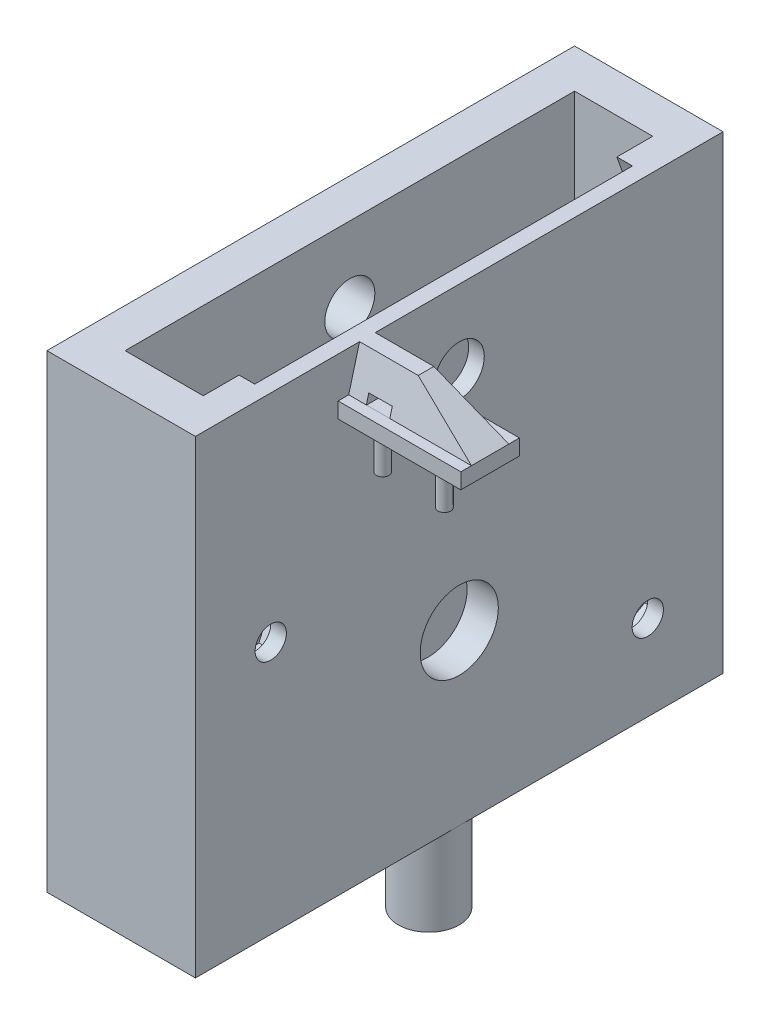
from build123d import *

# Parameters (mm, degrees)
SKETCH3_R                      = 4.953
POST_DEPTH                     = 13.97
SKETCH4_W                      = 24.13
SKETCH4_H                      = 85.725
BASE_DEPTH                     = 6.35
SKETCH5_W                      = 24.13
SKETCH5_H                      = 85.725
SKETCH5_W_2                    = 15.24
SKETCH5_H_2                    = 73.025
CAVITY_DEPTH                   = 69.85
MOTORHOLES_REACH               = 104.714
SKETCH8_R                      = 6.35
SKETCH8_R_2                    = 2.54
POWERSCREWHOLES_REACH          = 104.714
SKETCH7_R                      = 4.064
NUT_SOCKET_DEPTH               = 2.54
SKETCH12_W                     = 9.525
SKETCH12_H                     = 2.54
LIMITSWITCHSUPPORT_DEPTH       = 19.939
SKETCH20_R                     = 1.016
BOSS_EXTRUDE3_DEPTH            = 6.096
ZIPTIECUTOUT_REACH             = 106.211
SKETCH22_W                     = 3.81
SKETCH22_H                     = 1.524
ZIPTIECUTOUT_DIRECTION_2_REACH = 106.211


with BuildPart() as part:
    # Sketch3 → Post (new body)
    with BuildSketch(Plane(origin=(0, 0, 0), x_dir=(1, 0, 0), z_dir=(0, 1, 0))):
        with Locations(Location((0, 0, 0), (0, 0, 270))):
            Circle(SKETCH3_R)
    extrude(amount=POST_DEPTH)

    # Sketch4 → Base (add)
    with BuildSketch(Plane(origin=(0, 13.97, 0), x_dir=(1, 0, 0), z_dir=(0, 1, 0))):
        with Locations((-7.112, 0)):
            Rectangle(SKETCH4_W, SKETCH4_H)
    extrude(amount=BASE_DEPTH)

    # Sketch5 → Cavity (add)
    with BuildSketch(Plane(origin=(0, 20.32, 0), x_dir=(1, 0, 0), z_dir=(0, 1, 0))):
        with Locations((-7.112, 0)):
            Rectangle(SKETCH5_W, SKETCH5_H)
        with Locations((-5.207, 0)):
            Rectangle(SKETCH5_W_2, SKETCH5_H_2, mode=Mode.SUBTRACT)
    extrude(amount=CAVITY_DEPTH)

    # Sketch8 → MotorHoles (cut, up to next)
    with BuildSketch(Plane(origin=(4.953, 0, 0), x_dir=(0, 0, -1), z_dir=(1, 0, 0)), mode=Mode.PRIVATE) as motorholes_sk1:
        with Locations((0, 41.47)):
            Circle(SKETCH8_R)
    motorholes_tool1 = extrude(motorholes_sk1.sketch, amount=-MOTORHOLES_REACH, mode=Mode.PRIVATE) & part.part
    # Sketch8 → MotorHoles (cut, up to next)
    with BuildSketch(Plane(origin=(4.953, 0, 0), x_dir=(0, 0, -1), z_dir=(1, 0, 0)), mode=Mode.PRIVATE) as motorholes_sk2:
        with Locations((-30.629352104, 55.107066169)):
            Circle(SKETCH8_R_2)
    motorholes_tool2 = extrude(motorholes_sk2.sketch, amount=-MOTORHOLES_REACH, mode=Mode.PRIVATE) & part.part
    # Sketch8 → MotorHoles (cut, up to next)
    with BuildSketch(Plane(origin=(4.953, 0, 0), x_dir=(0, 0, -1), z_dir=(1, 0, 0)), mode=Mode.PRIVATE) as motorholes_sk3:
        with Locations((30.629352104, 27.832933831)):
            Circle(SKETCH8_R_2)
    motorholes_tool3 = extrude(motorholes_sk3.sketch, amount=-MOTORHOLES_REACH, mode=Mode.PRIVATE) & part.part
    add(motorholes_tool1.solids().sort_by_distance((4.953, 41.47, 0))[0], mode=Mode.SUBTRACT)
    add(motorholes_tool2.solids().sort_by_distance((4.953, 55.107066, 30.629352))[0], mode=Mode.SUBTRACT)
    add(motorholes_tool3.solids().sort_by_distance((4.953, 27.832934, -30.629352))[0], mode=Mode.SUBTRACT)

    # PowerscrewHoles: up to this face of the body (flat: up to its plane)
    powerscrewholes_end = Plane(part.part.faces().sort_by_distance((-19.177, 52.07, 0))[0])
    # Sketch7 → PowerscrewHoles (cut, up to the picked face)
    with BuildSketch(Plane(origin=(4.953, 0, 0), x_dir=(0, 0, -1), z_dir=(1, 0, 0)), mode=Mode.PRIVATE) as powerscrewholes_sk1:
        with Locations((0, 77.9825)):
            Circle(SKETCH7_R)
    powerscrewholes_tool1 = split(extrude(powerscrewholes_sk1.sketch, amount=-POWERSCREWHOLES_REACH, mode=Mode.PRIVATE), bisect_by=powerscrewholes_end, keep=Keep.BOTH, mode=Mode.PRIVATE)
    add(powerscrewholes_tool1.solids().sort_by(Axis((4.953, 77.9825, 0), (-1, 0, 0)))[0], mode=Mode.SUBTRACT)

    # Sketch10 → Nut Socket (add)
    with BuildSketch(Plane.ZY.offset(-2.413)):
        with BuildLine():
            Line((-36.5125, 90.17), (-30.688519739, 90.17))
            ThreePointArc((-30.688519739, 90.17), (-28.656384533, 61.577256158), (-5.028558234, 45.347641304))
            ThreePointArc((-5.028558234, 45.347641304), (0, 35.12), (5.028558234, 45.347641304))
            ThreePointArc((5.028558234, 45.347641304), (28.656384533, 61.577256158), (30.688519739, 90.17))
            Line((30.688519739, 90.17), (36.5125, 90.17))
            Line((36.5125, 90.17), (36.5125, 20.32))
            Line((36.5125, 20.32), (-36.5125, 20.32))
            Line((-36.5125, 20.32), (-36.5125, 90.17))
        make_face()
        Polygon((-26.057352104, 30.472579262), (-30.629352104, 33.112224692), (-35.201352104, 30.472579262), (-35.201352104, 25.1932884), (-30.629352104, 22.553642969), (-26.057352104, 25.1932884), align=None, mode=Mode.SUBTRACT)
        Polygon((32.712972872, 50.256351119), (35.872004948, 54.486177161), (33.788384179, 59.336892211), (28.545731335, 59.957781219), (25.38669926, 55.727955177), (27.470320028, 50.877240127), align=None, mode=Mode.SUBTRACT)
    extrude(amount=NUT_SOCKET_DEPTH)

    # Sketch12 → LimitSwitchSupport (add)
    with BuildSketch(Plane(origin=(4.953, 0, 0), x_dir=(0, 0, -1), z_dir=(1, 0, 0))):
        with Locations((-14.9225, 82.3005)):
            Rectangle(SKETCH12_W, SKETCH12_H)
    extrude(amount=LIMITSWITCHSUPPORT_DEPTH)

    # Rib2: read off the stored shape, not the designer's step
    # Rib2: loft between two sections, ruled curve by curve
    rib2_from = [
        Edge.make_line((14.478, 90.17, 13.6525), (14.478, 90.17, 16.1925)),
        Edge.make_line((4.953, 90.17, 16.1925), (14.478, 90.17, 16.1925)),
        Edge.make_line((4.953, 90.17, 13.6525), (14.478, 90.17, 13.6525)),
        Edge.make_line((4.953, 90.17, 13.6525), (4.953, 90.17, 16.1925)),
    ]
    rib2_to = [
        Edge.make_line((24.892, 83.5705, 11.884169305), (24.892, 83.5705, 17.960830695)),
        Edge.make_line((4.953, 83.5705, 17.960830695), (24.892, 83.5705, 17.960830695)),
        Edge.make_line((4.953, 83.5705, 11.884169305), (24.892, 83.5705, 11.884169305)),
        Edge.make_line((4.953, 83.5705, 11.884169305), (4.953, 83.5705, 17.960830695)),
    ]
    rib2 = Solid(Shell([*[Face.make_surface_from_curves(rib2_from[k], rib2_to[k]) for k in range(4)], Face(Wire(rib2_from)), Face(Wire(rib2_to))]))
    add(rib2)

    # Sketch20 → Boss-Extrude3 (add)
    with BuildSketch(Plane.XZ.offset(-81.0305)):
        with Locations(Location((9.906, 17.399, 0), (0, 0, 90))):
            Circle(SKETCH20_R)
        with Locations(Location((19.939, 17.399, 0), (0, 0, 90))):
            Circle(SKETCH20_R)
    extrude(amount=BOSS_EXTRUDE3_DEPTH)

    # ZipTieCutout: up to this plane
    ziptiecutout_end = Plane(origin=(2.8575, 90.17, 13.6525), z_dir=(0, -0.25881904510252135, 0.9659258262890681))
    # Sketch22 → ZipTieCutout (cut, up to the surface)
    with BuildSketch(Plane(origin=(0, 7.096196959, 14.9225), x_dir=(0.9999812488409504, 0.00612388491835337, 0), z_dir=(0, 0, 1)), mode=Mode.PRIVATE) as ziptiecutout_sk1:
        with Locations((10.192898839, 77.16364952)):
            Rectangle(SKETCH22_W, SKETCH22_H)
    ziptiecutout_tool1 = split(extrude(ziptiecutout_sk1.sketch, amount=-ZIPTIECUTOUT_REACH, mode=Mode.PRIVATE), bisect_by=ziptiecutout_end, keep=Keep.BOTH, mode=Mode.PRIVATE)
    add(ziptiecutout_tool1.solids().sort_by_distance((9.720166, 84.32082, 14.9225))[0], mode=Mode.SUBTRACT)

    # ZipTieCutout direction 2: up to this plane
    ziptiecutout_direction_2_end = Plane(origin=(2.8575, 90.17, 16.1925), z_dir=(0, 0.25881904510252135, 0.9659258262890681))
    # Sketch22 → ZipTieCutout direction 2 (cut, up to the surface)
    with BuildSketch(Plane(origin=(0, 7.096196959, 14.9225), x_dir=(0.9999812488409504, 0.00612388491835337, 0), z_dir=(0, 0, 1)), mode=Mode.PRIVATE) as ziptiecutout_direction_2_sk1:
        with Locations((10.192898839, 77.16364952)):
            Rectangle(SKETCH22_W, SKETCH22_H)
    ziptiecutout_direction_2_tool1 = split(extrude(ziptiecutout_direction_2_sk1.sketch, amount=ZIPTIECUTOUT_DIRECTION_2_REACH, mode=Mode.PRIVATE), bisect_by=ziptiecutout_direction_2_end, keep=Keep.BOTH, mode=Mode.PRIVATE)
    add(ziptiecutout_direction_2_tool1.solids().sort_by_distance((9.720166, 84.32082, 14.9225))[0], mode=Mode.SUBTRACT)


solid = part.part
